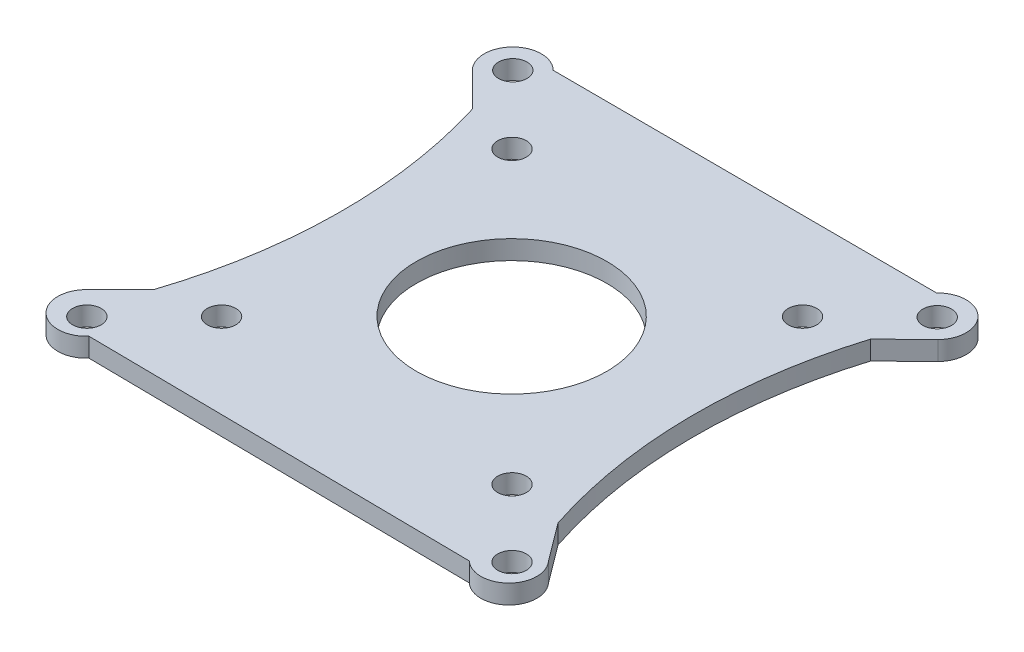
from build123d import *

# Parameters (mm, degrees)
SKETCH2_R           = 1.5
SKETCH2_R_2         = 10
BOSS_EXTRUDE2_DEPTH = 2


with BuildPart() as part:
    # Sketch2 → Boss-Extrude2 (new body)
    with BuildSketch(Plane(origin=(0, 0, 0), x_dir=(1, 0, 0), z_dir=(0, 1, 0))):
        with BuildLine():
            ThreePointArc((-20.239911035, 24.560123204), (-24.48240952, 24.56287929), (-24.485448206, 20.320380998))
            Line((-24.485448206, 20.320380998), (-20.95256537, 16.782198008))
            ThreePointArc((-20.95256537, 16.782198008), (-18.543928075, 0.189859194), (-21.26835448, -16.353560699))
            Line((-21.26835448, -16.353560699), (-24.803888386, -19.889094605))
            ThreePointArc((-24.803888386, -19.889094605), (-24.735429944, -24.198052489), (-20.430821488, -23.992746267))
            Line((-20.430821488, -23.992746267), (19.977507492, -24.460203678))
            ThreePointArc((19.977507492, -24.460203678), (24.042005224, -24.417963578), (24.174480105, -20.355405708))
            Line((24.174480105, -20.355405708), (21.176941694, -16.353560699))
            ThreePointArc((21.176941694, -16.353560699), (18.45251529, 0.189859194), (20.861152585, 16.782198008))
            Line((20.861152585, 16.782198008), (24.444109998, 20.269663589))
            ThreePointArc((24.444109998, 20.269663589), (24.389660177, 24.534058586), (20.12598923, 24.438457713))
            Line((20.12598923, 24.438457713), (-20.239911035, 24.560123204))
        make_face()
        with Locations((-22.362538412, 22.4401107)):
            Circle(SKETCH2_R, mode=Mode.SUBTRACT)
        with Locations((-15.25, 15.25)):
            Circle(SKETCH2_R, mode=Mode.SUBTRACT)
        with Locations((22.372000589, 22.269765495)):
            Circle(SKETCH2_R, mode=Mode.SUBTRACT)
        with Locations((-0.045706393, 0.003166749)):
            Circle(SKETCH2_R_2, mode=Mode.SUBTRACT)
        with Locations((15.25, 15.25)):
            Circle(SKETCH2_R, mode=Mode.SUBTRACT)
        with Locations((15.25, -15.25)):
            Circle(SKETCH2_R, mode=Mode.SUBTRACT)
        with Locations((-15.25, -15.25)):
            Circle(SKETCH2_R, mode=Mode.SUBTRACT)
        with Locations((-22.321067812, -22.321067812)):
            Circle(SKETCH2_R, mode=Mode.SUBTRACT)
        with Locations((22.321067812, -22.321067812)):
            Circle(SKETCH2_R, mode=Mode.SUBTRACT)
    extrude(amount=BOSS_EXTRUDE2_DEPTH)


solid = part.part
